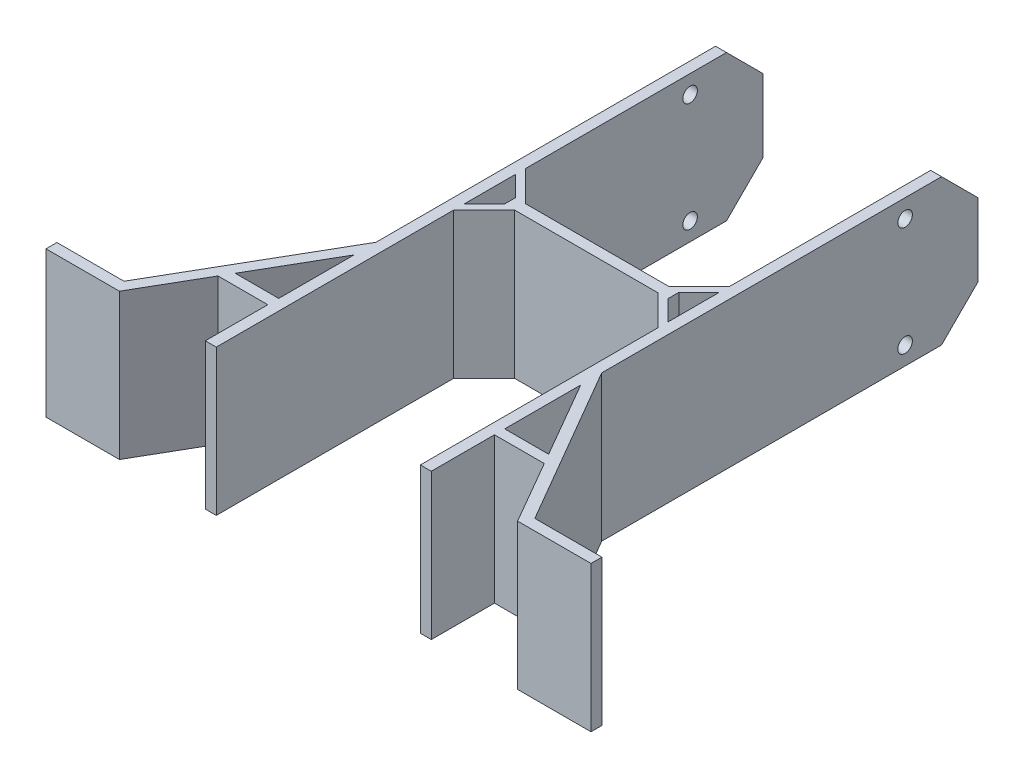
from build123d import *

# Parameters (mm, degrees)
SALIENTE_EXTRUIR1_DEPTH = 40
CROQUIS2_R              = 2
CORTAR_EXTRUIR1_DEPTH   = 136.646157054
CHAFL_N1_SIZE           = 10


with BuildPart() as part:
    # Croquis1 → Saliente-Extruir1 (new body)
    with BuildSketch(Plane(origin=(0, 0, 0), x_dir=(1, 0, 0), z_dir=(0, 1, 0))):
        Polygon((-28, 9.865463386), (-19.634536614, 1.5), (19.634536614, 1.5), (28, 9.865463386), (28, 75), (31, 75), (31, -28.243978644), (56.40842741, -72), (74.820633284, -72), (74.820633284, -75), (54.676376602, -75), (44.669393136, -57.667396206), (31, -57.667396206), (31, -75), (28, -75), (28, -9.865463386), (19.634536614, -1.5), (-19.634536614, -1.5), (-28, -9.865463386), (-28, -75), (-31, -75), (-31, -57.856759015), (-44.669393136, -57.856759015), (-54.567047933, -75), (-74.711304615, -75), (-74.711304615, -72), (-56.299098741, -72), (-31, -28.180675596), (-31, 75), (-28, 75), align=None)
        Polygon((-28, -7.037036261), (-22.454974268, -1.492010529), (-22.454974268, 1.492010529), (-28, 7.037036261), align=None, mode=Mode.SUBTRACT)
        Polygon((28, -7.011712537), (22.454974268, -1.466686806), (22.454974268, 1.466686806), (28, 7.011712537), align=None, mode=Mode.SUBTRACT)
        Polygon((31, -33.991312786), (43.046670997, -54.856759015), (31, -54.856759015), align=None, mode=Mode.SUBTRACT)
        Polygon((-31, -34.180675596), (-42.937342328, -54.856759015), (-31, -54.856759015), align=None, mode=Mode.SUBTRACT)
    extrude(amount=SALIENTE_EXTRUIR1_DEPTH)

    # Croquis2 → Cortar-Extruir1 (cut, through all)
    with BuildSketch(Plane(origin=(31, 0, 0), x_dir=(0, 0, -1), z_dir=(1, 0, 0))):
        with Locations((55, 35)):
            Circle(CROQUIS2_R)
        with Locations((55, 5)):
            Circle(CROQUIS2_R)
    extrude(amount=-CORTAR_EXTRUIR1_DEPTH, mode=Mode.SUBTRACT)

    # Chaflán1
    chafl_n1_edges = [part.edges().sort_by_distance(p)[0] for p in [
        (-29.5, 40, -75),
        (-29.5, 0, -75),
        (29.5, 0, -75),
        (29.5, 40, -75),
    ]]
    chamfer(chafl_n1_edges, length=CHAFL_N1_SIZE)


solid = part.part
